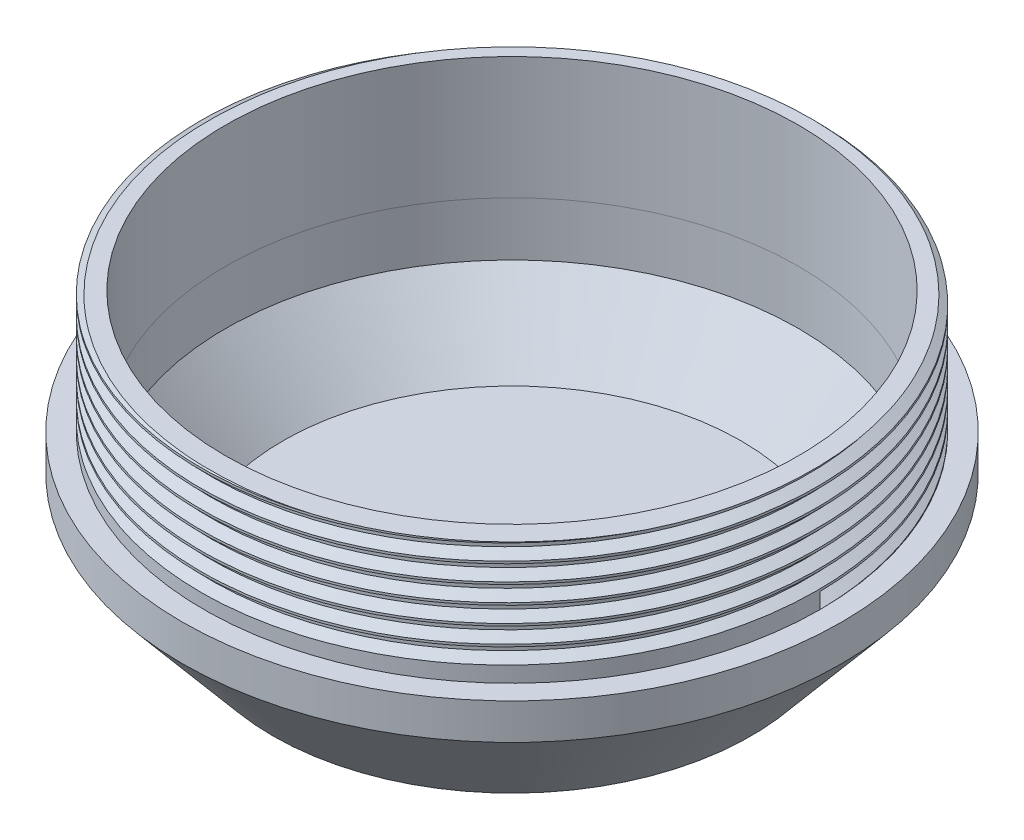
from build123d import *
from build123d.topology import SkipClean

# Parameters (mm, degrees)
CROQUIS7_W                  = 50
CROQUIS7_H                  = 50
SALIENTE_EXTRUIR3_DEPTH     = 100
CORTAR_EXTRUIR6_DEPTH       = 164.437433271
CORTAR_EXTRUIR7_DEPTH       = 155.261044567
CORTAR_EXTRUIR7_DEPTH_BACK  = 155.261044567
CORTAR_EXTRUIR8_DEPTH       = 155.261044567
CORTAR_EXTRUIR8_DEPTH_BACK  = 155.261044567
CORTAR_EXTRUIR9_DEPTH       = 155.261044567
CORTAR_EXTRUIR9_DEPTH_BACK  = 155.261044567
REDONDEO1_R                 = 2.5
CROQUIS14_W                 = 25
CROQUIS14_H                 = 25
SALIENTE_EXTRUIR4_DEPTH     = 5
CORTAR_EXTRUIR10_DEPTH      = 159.812688003
CORTAR_EXTRUIR10_DEPTH_BACK = 159.812688003
CROQUIS15_W                 = 104.470842551
CROQUIS15_H                 = 145.577912776
CROQUIS16_R                 = 42.806494468
CROQUIS16_R_2               = 39.806494468
SALIENTE_EXTRUIR5_DEPTH     = 17
ROSCA2_PITCH                = 2.5


with BuildPart() as part:
    # Croquis5 → Revolución2 (revolve)
    with BuildSketch(Plane.XY, mode=Mode.PRIVATE) as revoluci_n2_sk:
        Polygon((0, 0), (33.22, 0), (45.806494468, 15), (45.806494468, 40), (0, 40), (0, 37), (39.806494468, 37), (39.806494468, 12.516649925), (31.821077026, 3), (0, 3), align=None)
    revolve(revoluci_n2_sk.sketch.rotate(Axis((0, 0, 0), (0, 1, 0)), 90), axis=Axis((0, 0, 0), (0, 1, 0)))

    # Croquis7 → Saliente-Extruir3 (add)
    with BuildSketch(Plane(origin=(0, 40, 0), x_dir=(1, 0, 0), z_dir=(0, 1, 0))):
        Rectangle(CROQUIS7_W, CROQUIS7_H)
    extrude(amount=SALIENTE_EXTRUIR3_DEPTH)

    # Croquis10 → Cortar-Extruir6 (cut, through all)
    with BuildSketch(Plane.XY.offset(25)):
        Polygon((-25, 40), (-7.367301929, 140), (-25, 140), align=None)
        Polygon((25, 40), (25, 140), (7.367301929, 140), align=None)
    extrude(amount=-CORTAR_EXTRUIR6_DEPTH, mode=Mode.SUBTRACT)

    # Croquis11 → Cortar-Extruir7 (cut, two sides: drawn at the far end of the back side and taken through both)
    with BuildSketch(Plane(origin=(0, 0, 0), x_dir=(0, 0, -1), z_dir=(1, 0, 0)).offset(-CORTAR_EXTRUIR7_DEPTH_BACK)):
        Polygon((-25, 40), (-7.367301929, 140), (-25, 140), align=None)
        Polygon((25, 40), (25, 140), (7.367301929, 140), align=None)
    extrude(amount=CORTAR_EXTRUIR7_DEPTH + CORTAR_EXTRUIR7_DEPTH_BACK, mode=Mode.SUBTRACT)

    # Croquis12 → Cortar-Extruir8 (cut, two sides: drawn at the far end of the back side and taken through both)
    with BuildSketch(Plane.XY.offset(-CORTAR_EXTRUIR8_DEPTH_BACK)):
        Polygon((-19.922866941, 40), (19.922866941, 40), (2.29016887, 140), (-2.29016887, 140), align=None)
    extrude(amount=CORTAR_EXTRUIR8_DEPTH + CORTAR_EXTRUIR8_DEPTH_BACK, mode=Mode.SUBTRACT)

    # Croquis13 → Cortar-Extruir9 (cut, two sides: drawn at the far end of the back side and taken through both)
    with BuildSketch(Plane(origin=(0, 0, 0), x_dir=(0, 0, -1), z_dir=(1, 0, 0)).offset(-CORTAR_EXTRUIR9_DEPTH_BACK)):
        Polygon((-19.922866941, 40), (19.922866941, 40), (2.29016887, 140), (-2.29016887, 140), align=None)
    extrude(amount=CORTAR_EXTRUIR9_DEPTH + CORTAR_EXTRUIR9_DEPTH_BACK, mode=Mode.SUBTRACT)

    # Redondeo1
    redondeo1_edges = [part.edges().sort_by_distance(p)[0] for p in [
        (-11.106517905, 90, -11.106517905),
        (-11.106517905, 90, -16.183650965),
        (-16.183650965, 90, -16.183650965),
        (-16.183650965, 90, -11.106517905),
        (11.106517905, 90, -11.106517905),
        (16.183650965, 90, -11.106517905),
        (16.183650965, 90, -16.183650965),
        (11.106517905, 90, -16.183650965),
        (11.106517905, 90, 11.106517905),
        (11.106517905, 90, 16.183650965),
        (16.183650965, 90, 16.183650965),
        (16.183650965, 90, 11.106517905),
        (-11.106517905, 90, 11.106517905),
        (-11.106517905, 90, 16.183650965),
        (-16.183650965, 90, 11.106517905),
        (-16.183650965, 90, 16.183650965),
    ]]
    fillet(redondeo1_edges, radius=REDONDEO1_R - 0.0001)  # a hair under: the kernel refuses the full size

    # Croquis14 → Saliente-Extruir4 (add)
    with BuildSketch(Plane(origin=(0, 140, 0), x_dir=(1, 0, 0), z_dir=(0, 1, 0))):
        Rectangle(CROQUIS14_W, CROQUIS14_H)
    extrude(amount=SALIENTE_EXTRUIR4_DEPTH)

    # Croquis15 → Cortar-Extruir10 (cut, two sides: drawn at the far end of the back side and taken through both)
    with BuildSketch(Plane.XY.offset(-CORTAR_EXTRUIR10_DEPTH_BACK)):
        with Locations((-0.543381136, 92.788956388)):
            Rectangle(CROQUIS15_W, CROQUIS15_H)
    extrude(amount=CORTAR_EXTRUIR10_DEPTH + CORTAR_EXTRUIR10_DEPTH_BACK, mode=Mode.SUBTRACT)


with BuildPart() as body_2:
    # Croquis16 → Saliente-Extruir5 (new body)
    with BuildSketch(Plane(origin=(0, 20, 0), x_dir=(1, 0, 0), z_dir=(0, 1, 0))):
        with Locations(Location((0, 0, 0), (0, 0, 270))):
            Circle(CROQUIS16_R)
        with Locations(Location((0, 0, 0), (0, 0, 270))):
            Circle(CROQUIS16_R_2, mode=Mode.SUBTRACT)
    extrude(amount=SALIENTE_EXTRUIR5_DEPTH)

    # Rosca2: the profile of Perfil de rosca4 profile screwed along a right-hand helix of 6.8 turns, 10 arcs to a turn; built about Z, then put on its axis
    with SkipClean():  # the faces are left unmerged after this step: merging them gives an invalid solid
        rosca2_z = Axis((0, 0, 0), (0, 0, 1))
        rosca2_corners = [(42.806794468, 0, -0.000173205), (42.806794468, 0, 2.187673198), (41.45332978, 0, 1.406249997), (41.45332978, 0, 0.781249997)]
        with BuildLine(mode=Mode.PRIVATE) as rosca2_profile:
            Line(rosca2_corners[0], rosca2_corners[1])
            Line(rosca2_corners[1], rosca2_corners[2])
            Line(rosca2_corners[2], rosca2_corners[3])
            Line(rosca2_corners[3], rosca2_corners[0])
        rosca2_cap = Face(rosca2_profile.wire())
        rosca2_turn_angles = [0, 18, 36, 54, 72, 90, 108, 126, 144, 162, 180, 198, 216, 234, 252, 270, 288, 306, 324, 342, 360]
        rosca2_turn_weights = [1, 0.9510565162951535, 1, 0.9510565162951535, 1, 0.9510565162951535, 1, 0.9510565162951535, 1, 0.9510565162951535, 1, 0.9510565162951535, 1, 0.9510565162951535, 1, 0.9510565162951535, 1, 0.9510565162951535, 1, 0.9510565162951535, 1]
        rosca2_turn_rails = [Edge.make_bspline([Vector(p[0], p[1], 0).rotate(rosca2_z, rosca2_turn_angles[k]) / rosca2_turn_weights[k] + Vector(0, 0, p[2] + ROSCA2_PITCH * rosca2_turn_angles[k] / 360) for k in range(21)], [0, 0, 0, 1, 1, 2, 2, 3, 3, 4, 4, 5, 5, 6, 6, 7, 7, 8, 8, 9, 9, 10, 10, 10], 2, rosca2_turn_weights) for p in rosca2_corners]
        rosca2_turn_sides = [Face.make_surface_from_curves(rosca2_turn_rails[p[0]], rosca2_turn_rails[p[1]]) for p in [(0, 1), (1, 2), (2, 3), (3, 0)]]
        rosca2_last_angles = [2160, 2178, 2196, 2214, 2232, 2250, 2268, 2286, 2304, 2322, 2340, 2358, 2376, 2394, 2412, 2430, 2448]
        rosca2_last_weights = [1, 0.9510565162951535, 1, 0.9510565162951535, 1, 0.9510565162951535, 1, 0.9510565162951535, 1, 0.9510565162951535, 1, 0.9510565162951535, 1, 0.9510565162951535, 1, 0.9510565162951548, 1]
        rosca2_last_rails = [Edge.make_bspline([Vector(p[0], p[1], 0).rotate(rosca2_z, rosca2_last_angles[k]) / rosca2_last_weights[k] + Vector(0, 0, p[2] + ROSCA2_PITCH * rosca2_last_angles[k] / 360) for k in range(17)], [0, 0, 0, 1, 1, 2, 2, 3, 3, 4, 4, 5, 5, 6, 6, 7, 7, 8, 8, 8], 2, rosca2_last_weights) for p in rosca2_corners]
        rosca2_last_sides = [Face.make_surface_from_curves(rosca2_last_rails[p[0]], rosca2_last_rails[p[1]]) for p in [(0, 1), (1, 2), (2, 3), (3, 0)]]
        rosca2 = Plane(origin=(0, 20, 0), x_dir=(1, 0, 0), z_dir=(0, 1, 0)) * Solid(Shell([*[p.moved(Location((0, 0, ROSCA2_PITCH * i))) for i in range(6) for p in rosca2_turn_sides], *rosca2_last_sides, rosca2_cap, rosca2_cap.rotate(rosca2_z, 2448).moved(Location((0, 0, ROSCA2_PITCH * 2448 / 360)))]))
        add(rosca2, mode=Mode.SUBTRACT)


solid = Compound([part.part, body_2.part])
